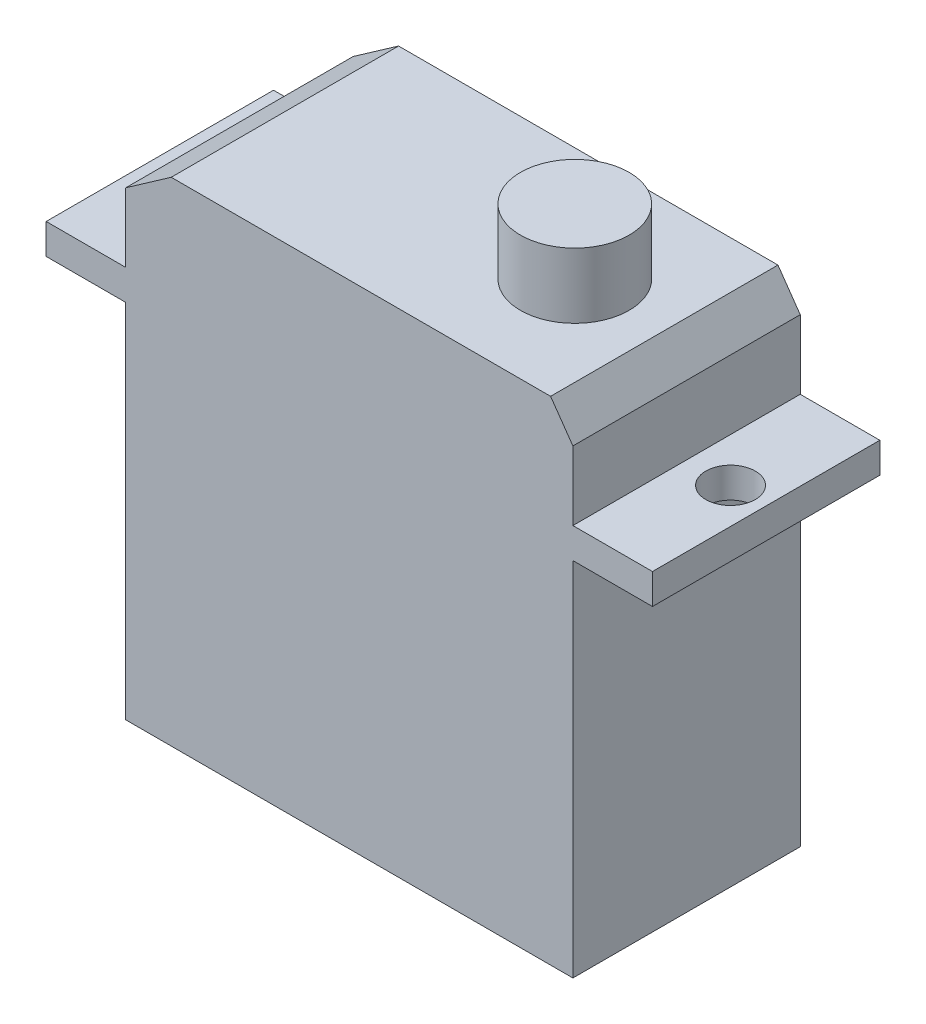
from build123d import *

# Parameters (mm, degrees)
BOSS_EXTRUDE1_DEPTH       = 7.5
SKETCH2_R                 = 3.587141307
BOSS_EXTRUDE2_DEPTH       = 4.3
F_4_CLEARANCE_HOLE1_D     = 3.2639
F_4_CLEARANCE_HOLE1_DEPTH = 5.84
F_4_CLEARANCE_HOLE1_TIP   = 0.980574487


with BuildPart() as part:
    # Sketch1 → Boss-Extrude1 (new, symmetric)
    with BuildSketch(Plane.XY):
        Polygon((-14.75, 11.925), (-20, 11.925), (-20, 13.925), (-14.75, 13.925), (-14.75, 18.474377385), (-11.75, 20.575), (13.27912821, 20.575), (14.75, 18.474377385), (14.75, 13.925), (20, 13.925), (20, 11.925), (14.75, 11.925), (14.75, -11.925), (-14.75, -11.925), align=None)
    extrude(amount=BOSS_EXTRUDE1_DEPTH, both=True)

    # Sketch2 → Boss-Extrude2 (add)
    with BuildSketch(Plane(origin=(0, 20.575, 0), x_dir=(1, 0, 0), z_dir=(0, 1, 0))):
        with Locations((7.375, 0)):
            Circle(SKETCH2_R)
    extrude(amount=BOSS_EXTRUDE2_DEPTH)

    # #4 Clearance Hole1
    with Locations(Plane(origin=(0, 13.925, 0), x_dir=(1, 0, 0), z_dir=(0, 1, 0))):
        with Locations((-17.65, 0), (17.65, 0)):
            Hole(F_4_CLEARANCE_HOLE1_D / 2, depth=F_4_CLEARANCE_HOLE1_DEPTH)
            with Locations((0, 0, -(F_4_CLEARANCE_HOLE1_DEPTH + F_4_CLEARANCE_HOLE1_TIP / 2))):  # 118° drill point
                Cone(0, F_4_CLEARANCE_HOLE1_D / 2, F_4_CLEARANCE_HOLE1_TIP, mode=Mode.SUBTRACT)


solid = part.part
